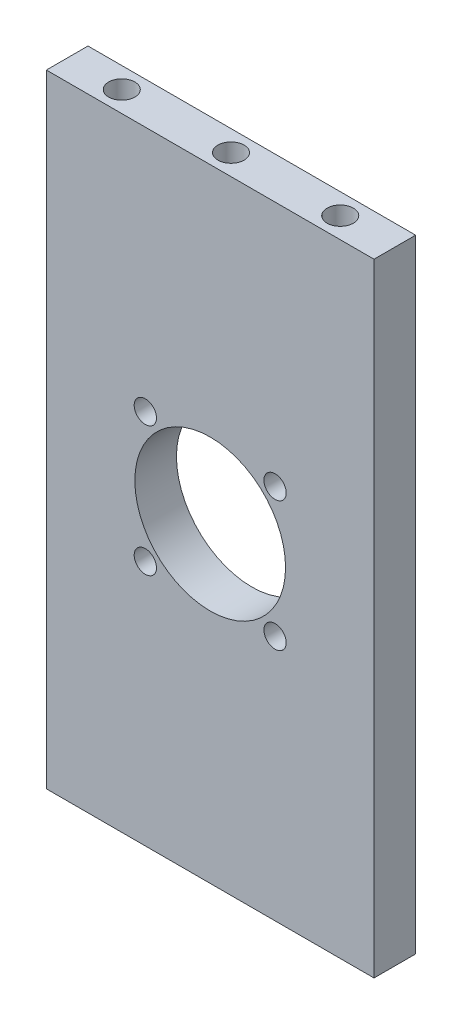
from build123d import *

# Parameters (mm, degrees)
SKETCH1_W                 = 50
SKETCH1_H                 = 95
BOSS_EXTRUDE1_DEPTH       = 6.35
F_4_0MM_DOWEL_HOLE1_D     = 4
F_4_0MM_DOWEL_HOLE1_DEPTH = 3.2
F_4_0MM_DOWEL_HOLE1_TIP   = 1.201721238
F_4_0MM_DOWEL_HOLE2_D     = 4
F_4_0MM_DOWEL_HOLE2_DEPTH = 3.2
F_4_0MM_DOWEL_HOLE2_TIP   = 1.201721238
SKETCH7_R                 = 11.5
CUT_EXTRUDE1_DEPTH        = 55.051572595
M3_CLEARANCE_HOLE1_D      = 3.4
M3_CLEARANCE_HOLE1_DEPTH  = 9.53
M3_CLEARANCE_HOLE1_TIP    = 1.021463052


with BuildPart() as part:
    # Sketch1 → Boss-Extrude1 (new body)
    with BuildSketch(Plane.XY):
        Rectangle(SKETCH1_W, SKETCH1_H)
    extrude(amount=-BOSS_EXTRUDE1_DEPTH)

    # Ø4.0mm Dowel Hole1
    with Locations(Plane.XZ.offset(47.5)):
        with Locations((-16.67, -3.175), (16.67, -3.175), (0, -3.175)):
            Hole(F_4_0MM_DOWEL_HOLE1_D / 2, depth=F_4_0MM_DOWEL_HOLE1_DEPTH)
            with Locations((0, 0, -(F_4_0MM_DOWEL_HOLE1_DEPTH + F_4_0MM_DOWEL_HOLE1_TIP / 2))):  # 118° drill point
                Cone(0, F_4_0MM_DOWEL_HOLE1_D / 2, F_4_0MM_DOWEL_HOLE1_TIP, mode=Mode.SUBTRACT)

    # Ø4.0mm Dowel Hole2
    with Locations(Plane(origin=(0, 47.5, 0), x_dir=(1, 0, 0), z_dir=(0, 1, 0))):
        with Locations((-16.67, 3.175), (0, 3.175), (16.67, 3.175)):
            Hole(F_4_0MM_DOWEL_HOLE2_D / 2, depth=F_4_0MM_DOWEL_HOLE2_DEPTH)
            with Locations((0, 0, -(F_4_0MM_DOWEL_HOLE2_DEPTH + F_4_0MM_DOWEL_HOLE2_TIP / 2))):  # 118° drill point
                Cone(0, F_4_0MM_DOWEL_HOLE2_D / 2, F_4_0MM_DOWEL_HOLE2_TIP, mode=Mode.SUBTRACT)

    # Sketch7 → Cut-Extrude1 (cut, through all)
    with BuildSketch(Plane(origin=(0, 0, -6.35), x_dir=(-1, 0, 0), z_dir=(0, 0, -1))):
        Circle(SKETCH7_R)
    extrude(amount=-CUT_EXTRUDE1_DEPTH, mode=Mode.SUBTRACT)

    # M3 Clearance Hole1
    with Locations(Plane(origin=(0, 0, -6.35), x_dir=(-1, 0, 0), z_dir=(0, 0, -1))):
        with Locations((-9.899494937, 9.899494937), (9.899494937, 9.899494937), (9.899494937, -9.899494937), (-9.899494937, -9.899494937), (0, 0)):
            Hole(M3_CLEARANCE_HOLE1_D / 2, depth=M3_CLEARANCE_HOLE1_DEPTH)
            with Locations((0, 0, -(M3_CLEARANCE_HOLE1_DEPTH + M3_CLEARANCE_HOLE1_TIP / 2))):  # 118° drill point
                Cone(0, M3_CLEARANCE_HOLE1_D / 2, M3_CLEARANCE_HOLE1_TIP, mode=Mode.SUBTRACT)


solid = part.part
